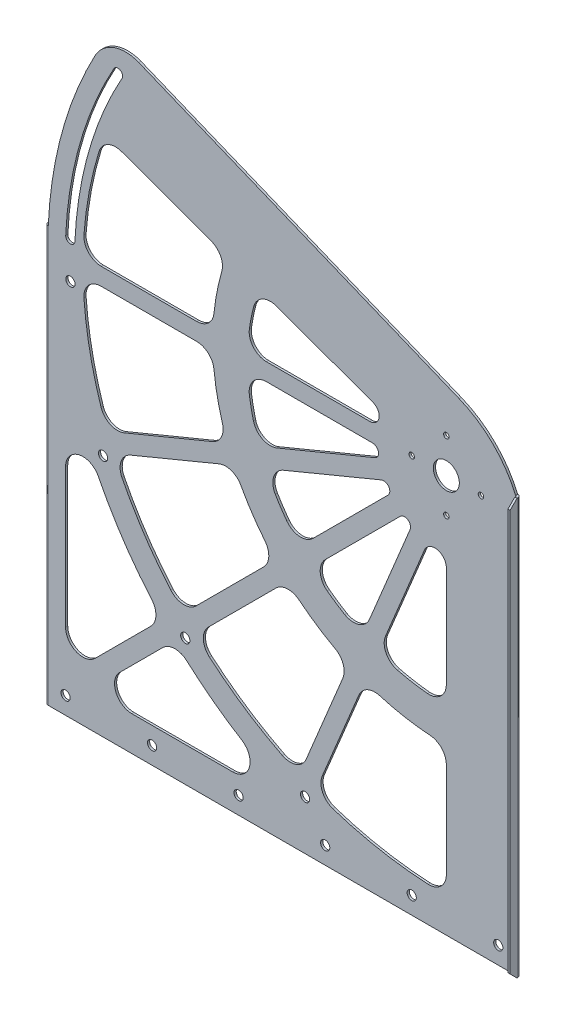
from build123d import *

# Parameters (mm, degrees)
SKETCH2_W           = 342.9
SKETCH2_H           = 457.2
BASE_FLANGE1_DEPTH  = 1.5875
CUT_EXTRUDE4_DEPTH  = 572.502204857
SKETCH11_R          = 3.3782
CUT_EXTRUDE2_DEPTH  = 572.502204857
CUT_EXTRUDE1_DEPTH  = 572.502204857
SKETCH12_R          = 3.3782
CUT_EXTRUDE3_DEPTH  = 561.721310547
CUT_EXTRUDE7_DEPTH  = 561.721310547
EDGE_FLANGE1_DEPTH  = 304.8
EDGE_FLANGE2_DEPTH  = 304.8
BREAK_CORNER1_START = -2.3241
BREAK_CORNER1_DEPTH = 347.5482
CUT_EXTRUDE6_DEPTH  = 563.199378399
CUT_EXTRUDE8_DEPTH  = 563.199378399


# Read off the part's stored shape, not the designer's step: Break-Corner1
# Sheet-metal steps are written as plain solids
with BuildPart() as part:
    # Sketch2 → Base-Flange1 (new body)
    with BuildSketch(Plane.XY):
        with Locations((171.45, 228.6)):
            Rectangle(SKETCH2_W, SKETCH2_H)
    extrude(amount=-BASE_FLANGE1_DEPTH)

    # Sketch13 → Cut-Extrude4 (cut, through all)
    with BuildSketch(Plane.XY):
        with BuildLine():
            ThreePointArc((48.171825547, 428.763803395), (23.257977777, 368.92393206), (12.792480929, 304.95531954))
            ThreePointArc((12.792480929, 304.95531954), (16.011788935, 301.425372453), (19.541736023, 304.64468046))
            ThreePointArc((19.541736023, 304.64468046), (29.754342049, 367.067539807), (54.066165518, 425.461425878))
            ThreePointArc((54.066165518, 425.461425878), (52.770184291, 430.059784622), (48.171825547, 428.763803395))
        make_face()
    extrude(amount=-CUT_EXTRUDE4_DEPTH, mode=Mode.SUBTRACT)

    # Sketch11 → Cut-Extrude2 (cut, through all)
    with BuildSketch(Plane.XY):
        with Locations((40.204262007, 178.747506397)):
            Circle(SKETCH11_R)
        with Locations((100.540612978, 93.0893172)):
            Circle(SKETCH11_R)
        with Locations((188.437827004, 36.064056205)):
            Circle(SKETCH11_R)
        with Locations((16.26184787, 277.486155391)):
            Circle(SKETCH11_R)
    extrude(amount=-CUT_EXTRUDE2_DEPTH, mode=Mode.SUBTRACT)

    # Sketch10 → Cut-Extrude1 (cut, through all)
    with BuildSketch(Plane.XY):
        with BuildLine():
            Line((-40.291044703, -621.894028175), (0, 304.8))
            ThreePointArc((0, 304.8), (10.145412323, 369.464788425), (34.422458536, 430.252034459))
            ThreePointArc((34.422458536, 430.252034459), (48.209724727, 442.150544976), (66.417211562, 441.762363709))
            Line((66.417211562, 441.762363709), (301.539322165, 345.67077664))
            ThreePointArc((301.539322165, 345.67077664), (326.271428246, 329.335722351), (342.9, 304.8))
            Line((342.9, 304.8), (704.017374327, -549.588337992))
            Line((704.017374327, -549.588337992), (524.644664306, 1296.858572009))
            Line((524.644664306, 1296.858572009), (-219.663754724, 1224.552881826))
            Line((-219.663754724, 1224.552881826), (-40.291044703, -621.894028175))
        make_face()
    extrude(amount=-CUT_EXTRUDE1_DEPTH, mode=Mode.SUBTRACT)

    # Sketch12 → Cut-Extrude3 (cut, through all)
    with BuildSketch(Plane.XY):
        with Locations((330.2, 12.7)):
            Circle(SKETCH12_R)
        with Locations((266.7, 12.7)):
            Circle(SKETCH12_R)
        with Locations((203.2, 12.7)):
            Circle(SKETCH12_R)
        with Locations((139.7, 12.7)):
            Circle(SKETCH12_R)
        with Locations((76.2, 12.7)):
            Circle(SKETCH12_R)
        with Locations((12.7, 12.7)):
            Circle(SKETCH12_R)
    extrude(amount=-CUT_EXTRUDE3_DEPTH, mode=Mode.SUBTRACT)

    # Sketch29 → Cut-Extrude7 (cut, through all)
    with BuildSketch(Plane.XY):
        with BuildLine():
            Line((12.7, 158.146603253), (12.7, 56.060512242))
            ThreePointArc((12.7, 56.060512242), (20.539920409, 44.327242179), (34.380256121, 47.080256121))
            Line((34.380256121, 47.080256121), (75.271534362, 87.971534362))
            ThreePointArc((75.271534362, 87.971534362), (78.982887179, 96.490203461), (75.900160018, 105.255969612))
            ThreePointArc((75.900160018, 105.255969612), (54.511524809, 133.339869751), (36.74893617, 163.846747796))
            ThreePointArc((36.74893617, 163.846747796), (22.470963415, 170.504222145), (12.7, 158.146603253))
        make_face()
        with BuildLine():
            Line((61.321024484, 25.4), (135.395173973, 25.4))
            ThreePointArc((135.395173973, 25.4), (147.613154271, 34.634317175), (142.063464443, 48.908510638))
            ThreePointArc((142.063464443, 48.908510638), (121.091555257, 63.169498916), (101.466712238, 79.233816455))
            ThreePointArc((101.466712238, 79.233816455), (92.644633062, 82.468287524), (84.01386555, 78.753353307))
            Line((84.01386555, 78.753353307), (52.340768363, 47.080256121))
            ThreePointArc((52.340768363, 47.080256121), (49.587754421, 33.239920409), (61.321024484, 25.4))
        make_face()
    extrude(amount=-CUT_EXTRUDE7_DEPTH, mode=Mode.SUBTRACT)

    # Edge-Flange1 section (across the edge) → Edge-Flange1 (add)
    with BuildSketch(Plane(origin=(-0.7366, 0, -1.5875), x_dir=(1, 0, 0), z_dir=(0, 1, 0))):
        with BuildLine():
            Line((-1.5875, 0.7366), (-1.5875, 6.35))
            Line((-1.5875, 6.35), (0, 6.35))
            Line((0, 6.35), (0, 0.7366))
            ThreePointArc((0, 0.7366), (0.215745145, 0.215745145), (0.7366, 0))
            Line((0.7366, 0), (0.7366, -1.5875))
            ThreePointArc((0.7366, -1.5875), (-0.90678687, -0.90678687), (-1.5875, 0.7366))
        make_face()
    extrude(amount=EDGE_FLANGE1_DEPTH)

    # Edge-Flange2 section (across the edge) → Edge-Flange2 (add)
    with BuildSketch(Plane(origin=(343.6366, 0, 0), x_dir=(-1, 0, 0), z_dir=(0, 1, 0))):
        with BuildLine():
            Line((-1.5875, 0.7366), (-1.5875, 6.35))
            Line((-1.5875, 6.35), (0, 6.35))
            Line((0, 6.35), (0, 0.7366))
            ThreePointArc((0, 0.7366), (0.215745145, 0.215745145), (0.7366, 0))
            Line((0.7366, 0), (0.7366, -1.5875))
            ThreePointArc((0.7366, -1.5875), (-0.90678687, -0.90678687), (-1.5875, 0.7366))
        make_face()
    extrude(amount=EDGE_FLANGE2_DEPTH)

    # Break-Corner1 outline → Break-Corner1 (cut)
    with BuildSketch(Plane.YZ.offset(BREAK_CORNER1_START)):
        Polygon((0, 6.35), (0, 1.27), (5.08, 6.35), align=None)
        Polygon((304.8, 6.35), (299.72, 6.35), (304.8, 1.27), align=None)
        Polygon((5.08, -7.9375), (0, -2.8575), (0, -7.9375), align=None)
        Polygon((304.8, -2.8575), (299.72, -7.9375), (304.8, -7.9375), align=None)
    extrude(amount=BREAK_CORNER1_DEPTH, mode=Mode.SUBTRACT)

    # Sketch27 → Cut-Extrude6 (cut, through all)
    with BuildSketch(Plane(origin=(0, 0, -1.5875), x_dir=(-1, 0, 0), z_dir=(0, 0, -1))):
        with BuildLine():
            ThreePointArc((-292.1, 268.7193), (-294.1193, 266.7), (-292.1, 264.6807))
            ThreePointArc((-292.1, 264.6807), (-290.0807, 266.7), (-292.1, 268.7193))
        make_face()
        with BuildLine():
            ThreePointArc((-317.5, 294.1193), (-319.5193, 292.1), (-317.5, 290.0807))
            ThreePointArc((-317.5, 290.0807), (-315.4807, 292.1), (-317.5, 294.1193))
        make_face()
        with BuildLine():
            ThreePointArc((-266.7, 294.1193), (-268.7193, 292.1), (-266.7, 290.0807))
            ThreePointArc((-266.7, 290.0807), (-264.6807, 292.1), (-266.7, 294.1193))
        make_face()
        with BuildLine():
            ThreePointArc((-292.1, 319.5193), (-294.1193, 317.5), (-292.1, 315.4807))
            ThreePointArc((-292.1, 315.4807), (-290.0807, 317.5), (-292.1, 319.5193))
        make_face()
        with BuildLine():
            ThreePointArc((-292.1, 282.575), (-282.575, 292.1), (-292.1, 301.625))
            ThreePointArc((-292.1, 301.625), (-301.625, 292.1), (-292.1, 282.575))
        make_face()
    extrude(amount=-CUT_EXTRUDE6_DEPTH, mode=Mode.SUBTRACT)

    # Sketch31 → Cut-Extrude8 (cut, through all)
    with BuildSketch(Plane.XY):
        with BuildLine():
            Line((236.010158972, 298.45), (160.117728463, 298.45))
            ThreePointArc((160.117728463, 298.45), (150.517430849, 302.835898382), (147.547988317, 312.964285714))
            ThreePointArc((147.547988317, 312.964285714), (148.918356849, 320.903117273), (150.724386397, 328.754309139))
            ThreePointArc((150.724386397, 328.754309139), (157.10804441, 336.808125269), (167.361573835, 337.501074193))
            Line((167.361573835, 337.501074193), (238.340638703, 311.666807325))
            ThreePointArc((238.340638703, 311.666807325), (242.720507913, 304.080651322), (236.010158972, 298.45))
        make_face()
        with BuildLine():
            Line((38.815382425, 285.75), (108.937995206, 285.75))
            ThreePointArc((108.937995206, 285.75), (117.441077812, 282.483323179), (121.569857606, 274.363793103))
            ThreePointArc((121.569857606, 274.363793103), (123.944363675, 258.65176429), (127.763339234, 243.227058323))
            ThreePointArc((127.763339234, 243.227058323), (127.056053726, 234.145575049), (120.450332842, 227.873570358))
            Line((120.450332842, 227.873570358), (55.665486127, 201.038808213))
            ThreePointArc((55.665486127, 201.038808213), (45.508442449, 201.229454161), (38.740676863, 208.805682189))
            ThreePointArc((38.740676863, 208.805682189), (30.524565716, 240.069411118), (26.151151546, 272.0975))
            ThreePointArc((26.151151546, 272.0975), (29.504454706, 281.686933773), (38.815382425, 285.75))
        make_face()
        with BuildLine():
            Line((239.63035192, 277.239550624), (167.734240877, 247.459206348))
            ThreePointArc((167.734240877, 247.459206348), (157.186311759, 247.837373252), (150.566938552, 256.058426546))
            ThreePointArc((150.566938552, 256.058426546), (148.856309797, 263.60705847), (147.547988317, 271.235714286))
            ThreePointArc((147.547988317, 271.235714286), (150.517430849, 281.364101618), (160.117728463, 285.75))
            Line((160.117728463, 285.75), (237.937518288, 285.75))
            ThreePointArc((237.937518288, 285.75), (242.276107756, 282.189411642), (239.63035192, 277.239550624))
        make_face()
        with BuildLine():
            Line((244.490431511, 265.506280561), (172.594320468, 235.725936286))
            ThreePointArc((172.594320468, 235.725936286), (165.403212643, 228.000019696), (166.535771494, 217.506253482))
            ThreePointArc((166.535771494, 217.506253482), (170.663863123, 210.958967467), (175.133014392, 204.639570218))
            ThreePointArc((175.133014392, 204.639570218), (184.394578707, 199.577431803), (194.284312739, 203.26456886))
            Line((194.284312739, 203.26456886), (249.311213835, 258.291469956))
            ThreePointArc((249.311213835, 258.291469956), (249.861343695, 263.877032163), (244.490431511, 265.506280561))
        make_face()
        with BuildLine():
            Line((258.291469956, 249.311213835), (203.26456886, 194.284312739))
            ThreePointArc((203.26456886, 194.284312739), (199.577431803, 184.394578707), (204.639570218, 175.133014392))
            ThreePointArc((204.639570218, 175.133014392), (210.958967467, 170.663863123), (217.506253482, 166.535771494))
            ThreePointArc((217.506253482, 166.535771494), (228.000019696, 165.403212643), (235.725936286, 172.594320468))
            Line((235.725936286, 172.594320468), (265.506280561, 244.490431511))
            ThreePointArc((265.506280561, 244.490431511), (263.877032163, 249.861343695), (258.291469956, 249.311213835))
        make_face()
        with BuildLine():
            Line((276.042067182, 236.739371154), (247.459206348, 167.734240877))
            ThreePointArc((247.459206348, 167.734240877), (247.837373252, 157.186311759), (256.058426546, 150.566938552))
            ThreePointArc((256.058426546, 150.566938552), (267.050258097, 148.214236526), (278.19047619, 146.713867073))
            ThreePointArc((278.19047619, 146.713867073), (287.941927406, 149.957976054), (292.1, 159.356139502))
            Line((292.1, 159.356139502), (292.1, 233.545249722))
            ThreePointArc((292.1, 233.545249722), (285.381707448, 241.731512882), (276.042067182, 236.739371154))
        make_face()
        with BuildLine():
            Line((53.716613431, 378.864457055), (119.467614934, 354.933049634))
            ThreePointArc((119.467614934, 354.933049634), (126.442026787, 348.760146294), (127.329203313, 339.488680706))
            ThreePointArc((127.329203313, 339.488680706), (123.795225148, 324.789528324), (121.569857606, 309.836206897))
            ThreePointArc((121.569857606, 309.836206897), (117.441077812, 301.716676821), (108.937995206, 298.45))
            Line((108.937995206, 298.45), (38.815382425, 298.45))
            ThreePointArc((38.815382425, 298.45), (29.504454706, 302.513066227), (26.151151546, 312.1025))
            ThreePointArc((26.151151546, 312.1025), (30.052406731, 341.697871544), (37.236605491, 370.671878809))
            ThreePointArc((37.236605491, 370.671878809), (43.719541522, 378.302646668), (53.716613431, 378.864457055))
        make_face()
        with BuildLine():
            Line((125.310412433, 216.140300295), (60.525565718, 189.30553815))
            ThreePointArc((60.525565718, 189.30553815), (53.478258299, 181.988616645), (54.049927575, 171.845881491))
            ThreePointArc((54.049927575, 171.845881491), (70.347054399, 143.929418854), (89.901862419, 118.1896692))
            ThreePointArc((89.901862419, 118.1896692), (99.053759471, 113.780058955), (108.510601282, 117.490857403))
            Line((108.510601282, 117.490857403), (158.094776294, 167.075032415))
            ThreePointArc((158.094776294, 167.075032415), (161.797474334, 175.397509118), (158.975587747, 184.058372086))
            ThreePointArc((158.975587747, 184.058372086), (149.544534971, 196.847483549), (141.338044298, 210.454821251))
            ThreePointArc((141.338044298, 210.454821251), (134.416339513, 216.376273278), (125.310412433, 216.140300295))
        make_face()
        with BuildLine():
            Line((167.075032415, 158.094776294), (117.490857403, 108.510601282))
            ThreePointArc((117.490857403, 108.510601282), (113.780058955, 99.053759471), (118.1896692, 89.901862419))
            ThreePointArc((118.1896692, 89.901862419), (143.929418854, 70.347054399), (171.845881491, 54.049927575))
            ThreePointArc((171.845881491, 54.049927575), (181.988616645, 53.478258299), (189.30553815, 60.525565718))
            Line((189.30553815, 60.525565718), (216.140300295, 125.310412433))
            ThreePointArc((216.140300295, 125.310412433), (216.376273278, 134.416339513), (210.454821251, 141.338044298))
            ThreePointArc((210.454821251, 141.338044298), (196.847483549, 149.544534971), (184.058372086, 158.975587747))
            ThreePointArc((184.058372086, 158.975587747), (175.397509118, 161.797474334), (167.075032415, 158.094776294))
        make_face()
        with BuildLine():
            Line((227.873570358, 120.450332842), (201.038808213, 55.665486127))
            ThreePointArc((201.038808213, 55.665486127), (201.229454161, 45.508442449), (208.805682189, 38.740676863))
            ThreePointArc((208.805682189, 38.740676863), (243.349590937, 29.893425681), (278.765, 25.73358362))
            ThreePointArc((278.765, 25.73358362), (288.152870958, 29.215674452), (292.1, 38.417698686))
            Line((292.1, 38.417698686), (292.1, 108.388453003))
            ThreePointArc((292.1, 108.388453003), (288.684757624, 117.053513641), (280.275862069, 121.058214865))
            ThreePointArc((280.275862069, 121.058214865), (261.56684521, 123.390696882), (243.227058323, 127.763339234))
            ThreePointArc((243.227058323, 127.763339234), (234.145575049, 127.056053726), (227.873570358, 120.450332842))
        make_face()
    extrude(amount=-CUT_EXTRUDE8_DEPTH, mode=Mode.SUBTRACT)


solid = part.part
